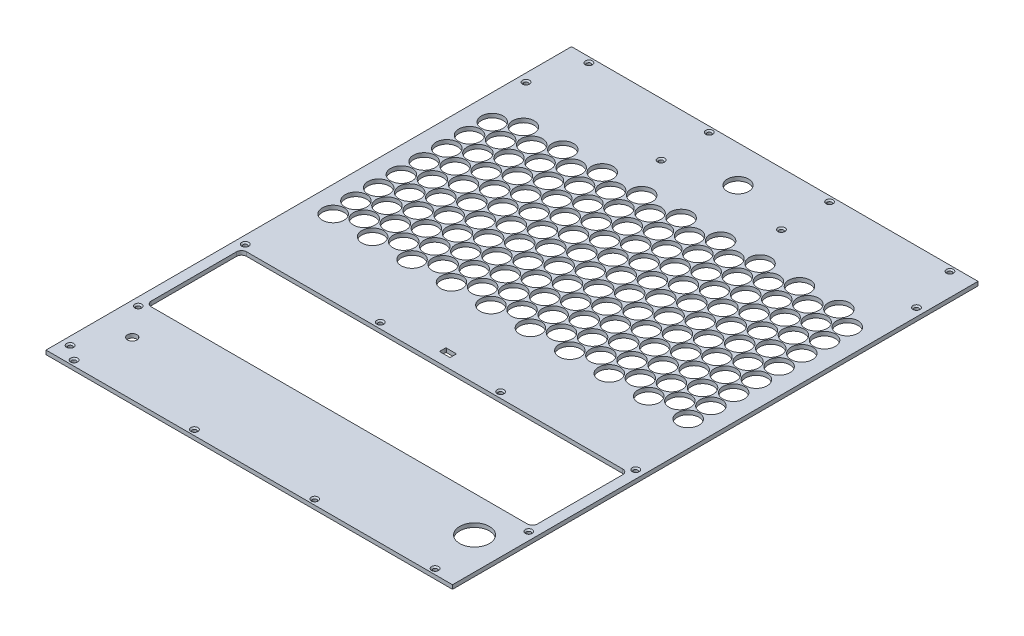
from build123d import *

# Parameters (mm, degrees)
SKIZZE1_W                       = 304
SKIZZE1_H                       = 393
AUFSATZ_LINEAR_AUSTRAGEN1_DEPTH = 3
SKIZZE3_R                       = 1.6
PCB_SCREWS_DEPTH                = 293.596992466
SKIZZE4_R                       = 8.075
TRANSDUCERS_DEPTH               = 293.596992466
TOF_SENSOR_DEPTH                = 293.596992466
DISPLAY_DEPTH                   = 293.596992466
SKIZZE7_R                       = 8
CAMERA_DEPTH                    = 293.596992466
SKIZZE9_R                       = 3.5
ROTARY_ENCODER_DEPTH            = 293.596992466
SKIZZE10_R                      = 11.1
RGB_BUTTON_DEPTH                = 293.596992466
SKIZZE8_R                       = 1.6
MAIN_SCREWS_DEPTH               = 293.596992466
FASE1_SIZE                      = 1


with BuildPart() as part:
    # Skizze1 → Aufsatz-Linear austragen1 (new body)
    with BuildSketch(Plane(origin=(0, 0, 0), x_dir=(1, 0, 0), z_dir=(0, 1, 0))):
        with Locations((0, 53.5)):
            Rectangle(SKIZZE1_W, SKIZZE1_H)
    extrude(amount=AUFSATZ_LINEAR_AUSTRAGEN1_DEPTH)

    # Skizze3 → PCB-Screws (cut, through all)
    with BuildSketch(Plane(origin=(0, 3, 0), x_dir=(1, 0, 0), z_dir=(0, 1, 0))):
        with Locations((-146, -131)):
            Circle(SKIZZE3_R)
        with Locations((-146, -80)):
            Circle(SKIZZE3_R)
        with Locations((-146, 0)):
            Circle(SKIZZE3_R)
        with Locations((-146, 210)):
            Circle(SKIZZE3_R)
        with Locations((-45, 0)):
            Circle(SKIZZE3_R)
        with Locations((-45, 210)):
            Circle(SKIZZE3_R)
        with Locations((45, 210)):
            Circle(SKIZZE3_R)
        with Locations((45, 0)):
            Circle(SKIZZE3_R)
        with Locations((146, 210)):
            Circle(SKIZZE3_R)
        with Locations((146, 0)):
            Circle(SKIZZE3_R)
        with Locations((146, -80)):
            Circle(SKIZZE3_R)
    extrude(amount=-PCB_SCREWS_DEPTH, mode=Mode.SUBTRACT)

    # Skizze4 → Transducers (cut, through all)
    with BuildSketch(Plane(origin=(0, 3, 0), x_dir=(1, 0, 0), z_dir=(0, 1, 0))):
        with Locations((0, 61)):
            Circle(SKIZZE4_R)
        with Locations((0, 78)):
            Circle(SKIZZE4_R)
        with Locations((0, 95)):
            Circle(SKIZZE4_R)
        with Locations((0, 112)):
            Circle(SKIZZE4_R)
        with Locations((0, 129)):
            Circle(SKIZZE4_R)
        with Locations((0, 146)):
            Circle(SKIZZE4_R)
        with Locations((0, 163)):
            Circle(SKIZZE4_R)
        with Locations((0, 180)):
            Circle(SKIZZE4_R)
        with Locations((-14.75, 52.5)):
            Circle(SKIZZE4_R)
        with Locations((-14.75, 69.5)):
            Circle(SKIZZE4_R)
        with Locations((-14.75, 86.5)):
            Circle(SKIZZE4_R)
        with Locations((-14.75, 103.5)):
            Circle(SKIZZE4_R)
        with Locations((-14.75, 120.5)):
            Circle(SKIZZE4_R)
        with Locations((-14.75, 137.5)):
            Circle(SKIZZE4_R)
        with Locations((-14.75, 154.5)):
            Circle(SKIZZE4_R)
        with Locations((-14.75, 171.5)):
            Circle(SKIZZE4_R)
        with Locations((-29.5, 61)):
            Circle(SKIZZE4_R)
        with Locations((-29.5, 78)):
            Circle(SKIZZE4_R)
        with Locations((-29.5, 95)):
            Circle(SKIZZE4_R)
        with Locations((-29.5, 112)):
            Circle(SKIZZE4_R)
        with Locations((-29.5, 129)):
            Circle(SKIZZE4_R)
        with Locations((-29.5, 146)):
            Circle(SKIZZE4_R)
        with Locations((-29.5, 163)):
            Circle(SKIZZE4_R)
        with Locations((-29.5, 180)):
            Circle(SKIZZE4_R)
        with Locations((-44.25, 52.5)):
            Circle(SKIZZE4_R)
        with Locations((-44.25, 69.5)):
            Circle(SKIZZE4_R)
        with Locations((-44.25, 86.5)):
            Circle(SKIZZE4_R)
        with Locations((-44.25, 103.5)):
            Circle(SKIZZE4_R)
        with Locations((-44.25, 120.5)):
            Circle(SKIZZE4_R)
        with Locations((-44.25, 137.5)):
            Circle(SKIZZE4_R)
        with Locations((-44.25, 154.5)):
            Circle(SKIZZE4_R)
        with Locations((-44.25, 171.5)):
            Circle(SKIZZE4_R)
        with Locations((-59, 61)):
            Circle(SKIZZE4_R)
        with Locations((-59, 78)):
            Circle(SKIZZE4_R)
        with Locations((-59, 95)):
            Circle(SKIZZE4_R)
        with Locations((-59, 112)):
            Circle(SKIZZE4_R)
        with Locations((-59, 129)):
            Circle(SKIZZE4_R)
        with Locations((-59, 146)):
            Circle(SKIZZE4_R)
        with Locations((-59, 163)):
            Circle(SKIZZE4_R)
        with Locations((-59, 180)):
            Circle(SKIZZE4_R)
        with Locations((-73.75, 52.5)):
            Circle(SKIZZE4_R)
        with Locations((-73.75, 69.5)):
            Circle(SKIZZE4_R)
        with Locations((-73.75, 86.5)):
            Circle(SKIZZE4_R)
        with Locations((-73.75, 103.5)):
            Circle(SKIZZE4_R)
        with Locations((-73.75, 120.5)):
            Circle(SKIZZE4_R)
        with Locations((-73.75, 137.5)):
            Circle(SKIZZE4_R)
        with Locations((-73.75, 154.5)):
            Circle(SKIZZE4_R)
        with Locations((-73.75, 171.5)):
            Circle(SKIZZE4_R)
        with Locations((-88.5, 61)):
            Circle(SKIZZE4_R)
        with Locations((-88.5, 78)):
            Circle(SKIZZE4_R)
        with Locations((-88.5, 95)):
            Circle(SKIZZE4_R)
        with Locations((-88.5, 112)):
            Circle(SKIZZE4_R)
        with Locations((-88.5, 129)):
            Circle(SKIZZE4_R)
        with Locations((-88.5, 146)):
            Circle(SKIZZE4_R)
        with Locations((-88.5, 163)):
            Circle(SKIZZE4_R)
        with Locations((-88.5, 180)):
            Circle(SKIZZE4_R)
        with Locations((-103.25, 52.5)):
            Circle(SKIZZE4_R)
        with Locations((-103.25, 69.5)):
            Circle(SKIZZE4_R)
        with Locations((-103.25, 86.5)):
            Circle(SKIZZE4_R)
        with Locations((-103.25, 103.5)):
            Circle(SKIZZE4_R)
        with Locations((-103.25, 120.5)):
            Circle(SKIZZE4_R)
        with Locations((-103.25, 137.5)):
            Circle(SKIZZE4_R)
        with Locations((-103.25, 154.5)):
            Circle(SKIZZE4_R)
        with Locations((-103.25, 171.5)):
            Circle(SKIZZE4_R)
        with Locations((-118, 61)):
            Circle(SKIZZE4_R)
        with Locations((-118, 78)):
            Circle(SKIZZE4_R)
        with Locations((-118, 95)):
            Circle(SKIZZE4_R)
        with Locations((-118, 112)):
            Circle(SKIZZE4_R)
        with Locations((-118, 129)):
            Circle(SKIZZE4_R)
        with Locations((-118, 146)):
            Circle(SKIZZE4_R)
        with Locations((-118, 163)):
            Circle(SKIZZE4_R)
        with Locations((-118, 180)):
            Circle(SKIZZE4_R)
        with Locations((-132.75, 52.5)):
            Circle(SKIZZE4_R)
        with Locations((-132.75, 69.5)):
            Circle(SKIZZE4_R)
        with Locations((-132.75, 86.5)):
            Circle(SKIZZE4_R)
        with Locations((-132.75, 103.5)):
            Circle(SKIZZE4_R)
        with Locations((-132.75, 120.5)):
            Circle(SKIZZE4_R)
        with Locations((-132.75, 137.5)):
            Circle(SKIZZE4_R)
        with Locations((-132.75, 154.5)):
            Circle(SKIZZE4_R)
        with Locations((-132.75, 171.5)):
            Circle(SKIZZE4_R)
        with Locations((29.5, 61)):
            Circle(SKIZZE4_R)
        with Locations((29.5, 78)):
            Circle(SKIZZE4_R)
        with Locations((29.5, 95)):
            Circle(SKIZZE4_R)
        with Locations((29.5, 112)):
            Circle(SKIZZE4_R)
        with Locations((29.5, 129)):
            Circle(SKIZZE4_R)
        with Locations((29.5, 146)):
            Circle(SKIZZE4_R)
        with Locations((29.5, 163)):
            Circle(SKIZZE4_R)
        with Locations((29.5, 180)):
            Circle(SKIZZE4_R)
        with Locations((14.75, 52.5)):
            Circle(SKIZZE4_R)
        with Locations((14.75, 69.5)):
            Circle(SKIZZE4_R)
        with Locations((14.75, 86.5)):
            Circle(SKIZZE4_R)
        with Locations((14.75, 103.5)):
            Circle(SKIZZE4_R)
        with Locations((14.75, 120.5)):
            Circle(SKIZZE4_R)
        with Locations((14.75, 137.5)):
            Circle(SKIZZE4_R)
        with Locations((14.75, 154.5)):
            Circle(SKIZZE4_R)
        with Locations((14.75, 171.5)):
            Circle(SKIZZE4_R)
        with Locations((59, 61)):
            Circle(SKIZZE4_R)
        with Locations((59, 78)):
            Circle(SKIZZE4_R)
        with Locations((59, 95)):
            Circle(SKIZZE4_R)
        with Locations((59, 112)):
            Circle(SKIZZE4_R)
        with Locations((59, 129)):
            Circle(SKIZZE4_R)
        with Locations((59, 146)):
            Circle(SKIZZE4_R)
        with Locations((59, 163)):
            Circle(SKIZZE4_R)
        with Locations((59, 180)):
            Circle(SKIZZE4_R)
        with Locations((44.25, 52.5)):
            Circle(SKIZZE4_R)
        with Locations((44.25, 69.5)):
            Circle(SKIZZE4_R)
        with Locations((44.25, 86.5)):
            Circle(SKIZZE4_R)
        with Locations((44.25, 103.5)):
            Circle(SKIZZE4_R)
        with Locations((44.25, 120.5)):
            Circle(SKIZZE4_R)
        with Locations((44.25, 137.5)):
            Circle(SKIZZE4_R)
        with Locations((44.25, 154.5)):
            Circle(SKIZZE4_R)
        with Locations((44.25, 171.5)):
            Circle(SKIZZE4_R)
        with Locations((88.5, 61)):
            Circle(SKIZZE4_R)
        with Locations((88.5, 78)):
            Circle(SKIZZE4_R)
        with Locations((88.5, 95)):
            Circle(SKIZZE4_R)
        with Locations((88.5, 112)):
            Circle(SKIZZE4_R)
        with Locations((88.5, 129)):
            Circle(SKIZZE4_R)
        with Locations((88.5, 146)):
            Circle(SKIZZE4_R)
        with Locations((88.5, 163)):
            Circle(SKIZZE4_R)
        with Locations((88.5, 180)):
            Circle(SKIZZE4_R)
        with Locations((73.75, 52.5)):
            Circle(SKIZZE4_R)
        with Locations((73.75, 69.5)):
            Circle(SKIZZE4_R)
        with Locations((73.75, 86.5)):
            Circle(SKIZZE4_R)
        with Locations((73.75, 103.5)):
            Circle(SKIZZE4_R)
        with Locations((73.75, 120.5)):
            Circle(SKIZZE4_R)
        with Locations((73.75, 137.5)):
            Circle(SKIZZE4_R)
        with Locations((73.75, 154.5)):
            Circle(SKIZZE4_R)
        with Locations((73.75, 171.5)):
            Circle(SKIZZE4_R)
        with Locations((118, 61)):
            Circle(SKIZZE4_R)
        with Locations((118, 78)):
            Circle(SKIZZE4_R)
        with Locations((118, 95)):
            Circle(SKIZZE4_R)
        with Locations((118, 112)):
            Circle(SKIZZE4_R)
        with Locations((118, 129)):
            Circle(SKIZZE4_R)
        with Locations((118, 146)):
            Circle(SKIZZE4_R)
        with Locations((118, 163)):
            Circle(SKIZZE4_R)
        with Locations((118, 180)):
            Circle(SKIZZE4_R)
        with Locations((103.25, 52.5)):
            Circle(SKIZZE4_R)
        with Locations((103.25, 69.5)):
            Circle(SKIZZE4_R)
        with Locations((103.25, 86.5)):
            Circle(SKIZZE4_R)
        with Locations((103.25, 103.5)):
            Circle(SKIZZE4_R)
        with Locations((103.25, 120.5)):
            Circle(SKIZZE4_R)
        with Locations((103.25, 137.5)):
            Circle(SKIZZE4_R)
        with Locations((103.25, 154.5)):
            Circle(SKIZZE4_R)
        with Locations((103.25, 171.5)):
            Circle(SKIZZE4_R)
        with Locations((132.75, 52.5)):
            Circle(SKIZZE4_R)
        with Locations((132.75, 69.5)):
            Circle(SKIZZE4_R)
        with Locations((132.75, 86.5)):
            Circle(SKIZZE4_R)
        with Locations((132.75, 103.5)):
            Circle(SKIZZE4_R)
        with Locations((132.75, 120.5)):
            Circle(SKIZZE4_R)
        with Locations((132.75, 137.5)):
            Circle(SKIZZE4_R)
        with Locations((132.75, 154.5)):
            Circle(SKIZZE4_R)
        with Locations((132.75, 171.5)):
            Circle(SKIZZE4_R)
    extrude(amount=-TRANSDUCERS_DEPTH, mode=Mode.SUBTRACT)

    # Skizze5 → ToF-Sensor (cut, through all)
    with BuildSketch(Plane(origin=(0, 3, 0), x_dir=(1, 0, 0), z_dir=(0, 1, 0))):
        with BuildLine():
            Line((3.45, 8.02), (-3.45, 8.02))
            ThreePointArc((-3.45, 8.02), (-3.803553391, 7.873553391), (-3.95, 7.52))
            Line((-3.95, 7.52), (-3.95, 3.72))
            ThreePointArc((-3.95, 3.72), (-3.803553391, 3.366446609), (-3.45, 3.22))
            Line((-3.45, 3.22), (3.45, 3.22))
            ThreePointArc((3.45, 3.22), (3.803553391, 3.366446609), (3.95, 3.72))
            Line((3.95, 3.72), (3.95, 7.52))
            ThreePointArc((3.95, 7.52), (3.803553391, 7.873553391), (3.45, 8.02))
        make_face()
    extrude(amount=-TOF_SENSOR_DEPTH, mode=Mode.SUBTRACT)

    # Skizze6 → Display (cut, through all)
    with BuildSketch(Plane(origin=(0, 3, 0), x_dir=(1, 0, 0), z_dir=(0, 1, 0))):
        with BuildLine():
            ThreePointArc((-140.65, -4.35), (-143.301650429, -5.448349571), (-144.4, -8.1))
            Line((-144.4, -8.1), (-144.4, -71.9))
            ThreePointArc((-144.4, -71.9), (-143.301650429, -74.551650429), (-140.65, -75.65))
            Line((-140.65, -75.65), (140.65, -75.65))
            ThreePointArc((140.65, -75.65), (143.301650429, -74.551650429), (144.4, -71.9))
            Line((144.4, -71.9), (144.4, -8.1))
            ThreePointArc((144.4, -8.1), (143.301650429, -5.448349571), (140.65, -4.35))
            Line((140.65, -4.35), (-140.65, -4.35))
        make_face()
    extrude(amount=-DISPLAY_DEPTH, mode=Mode.SUBTRACT)

    # Skizze7 → Camera (cut, through all)
    with BuildSketch(Plane(origin=(0, 3, 0), x_dir=(1, 0, 0), z_dir=(0, 1, 0))):
        with Locations((0, 222.5)):
            Circle(SKIZZE7_R)
    extrude(amount=-CAMERA_DEPTH, mode=Mode.SUBTRACT)

    # Skizze9 → Rotary Encoder (cut, through all)
    with BuildSketch(Plane(origin=(0, 3, 0), x_dir=(1, 0, 0), z_dir=(0, 1, 0))):
        with Locations((-128, -102.5)):
            Circle(SKIZZE9_R)
    extrude(amount=-ROTARY_ENCODER_DEPTH, mode=Mode.SUBTRACT)

    # Skizze10 → RGB-Button (cut, through all)
    with BuildSketch(Plane(origin=(0, 3, 0), x_dir=(1, 0, 0), z_dir=(0, 1, 0))):
        with Locations((128, -102.5)):
            Circle(SKIZZE10_R)
    extrude(amount=-RGB_BUTTON_DEPTH, mode=Mode.SUBTRACT)

    # Skizze8 → Main-Screws (cut, through all)
    with BuildSketch(Plane(origin=(0, 3, 0), x_dir=(1, 0, 0), z_dir=(0, 1, 0))):
        with Locations((-135, -139)):
            Circle(SKIZZE8_R)
        with Locations((-45, -139)):
            Circle(SKIZZE8_R)
        with Locations((45, -139)):
            Circle(SKIZZE8_R)
        with Locations((135, -139)):
            Circle(SKIZZE8_R)
        with Locations((135, 246)):
            Circle(SKIZZE8_R)
        with Locations((45, 246)):
            Circle(SKIZZE8_R)
        with Locations((-45, 246)):
            Circle(SKIZZE8_R)
        with Locations((-135, 246)):
            Circle(SKIZZE8_R)
    extrude(amount=-MAIN_SCREWS_DEPTH, mode=Mode.SUBTRACT)

    # Fase1
    fase1_edges = [part.edges().sort_by_distance(p)[0] for p in [
        (133.4, 3, -246),
        (144.4, 3, -210),
        (43.4, 3, -246),
        (43.4, 3, -210),
        (-46.6, 3, -246),
        (-46.6, 3, -210),
        (-136.6, 3, -246),
        (-147.6, 3, -210),
        (144.4, 3, 0),
        (43.4, 3, 0),
        (-46.6, 3, 0),
        (-147.6, 3, 0),
        (144.4, 3, 80),
        (133.4, 3, 139),
        (43.4, 3, 139),
        (-46.6, 3, 139),
        (-147.6, 3, 80),
        (-136.6, 3, 139),
        (-147.6, 3, 131),
    ]]
    chamfer(fase1_edges, length=FASE1_SIZE)


solid = part.part
